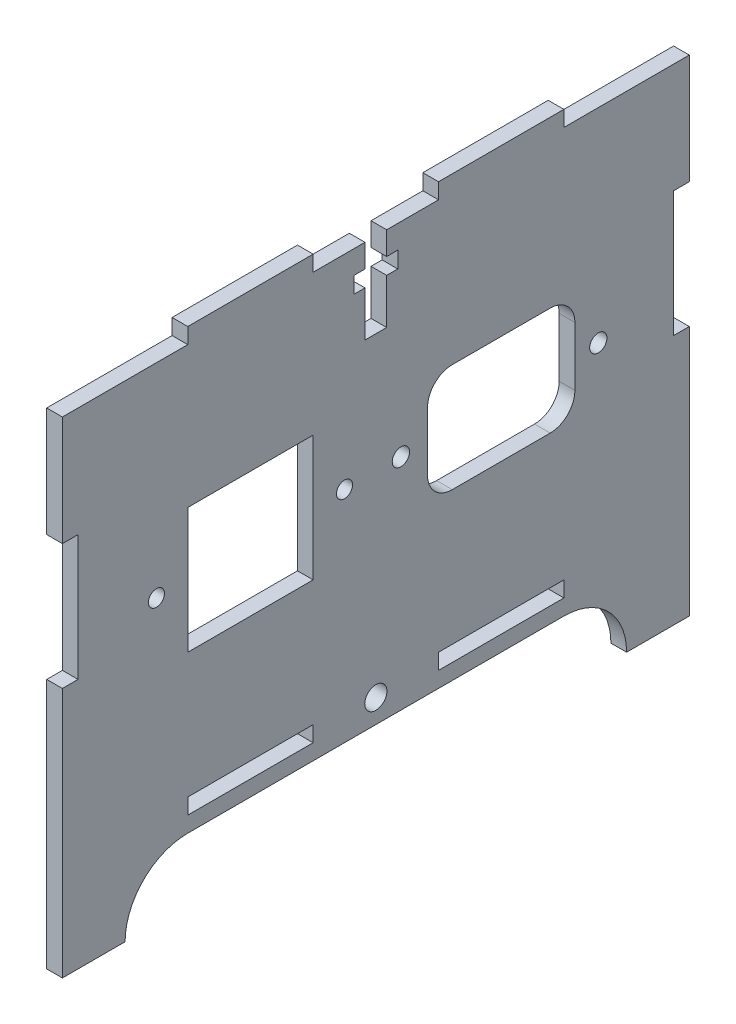
from build123d import *

# Parameters (mm, degrees)
SKETCH1_W                 = 127
SKETCH1_H                 = 101.6
BOSS_EXTRUDE1_DEPTH       = 3.175
SKETCH2_W                 = 25.4
SKETCH2_H                 = 3.175
CUT_EXTRUDE1_DEPTH        = 6.35
LPATTERN1_COUNT           = 3
LPATTERN1_PITCH           = 50.8
CUT_EXTRUDE4_DEPTH        = 6.35
SKETCH8_W                 = 3.175
SKETCH8_H                 = 25.4
CUT_EXTRUDE6_DEPTH        = 6.35
SKETCH9_W                 = 25.4
SKETCH9_H                 = 3.175
CUT_EXTRUDE7_DEPTH        = 6.35
LPATTERN6_COUNT           = 2
LPATTERN6_PITCH           = 50.8
SKETCH16_W                = 4.3942
SKETCH16_H                = 17.145
SKETCH16_W_2              = 8.89
SKETCH16_H_2              = 3.302
CUT_EXTRUDE14_DEPTH       = 6.35
F_8_CLEARANCE_HOLE1_D     = 4.4958
F_8_CLEARANCE_HOLE1_DEPTH = 10.16
F_8_CLEARANCE_HOLE1_TIP   = 1.350674586
SKETCH20_R                = 1.75
CUT_EXTRUDE16_DEPTH       = 7.62
SKETCH25_W                = 25.4
SKETCH25_H                = 25.4
CUT_EXTRUDE20_DEPTH       = 7.62
F_4_CLEARANCE_HOLE1_D     = 3.2639
F_4_CLEARANCE_HOLE1_DEPTH = 10.16
F_4_CLEARANCE_HOLE1_TIP   = 0.980574487


with BuildPart() as part:
    # Sketch1 → Boss-Extrude1 (new body)
    with BuildSketch(Plane(origin=(0, 0, 0), x_dir=(0, 0, -1), z_dir=(1, 0, 0))):
        Rectangle(SKETCH1_W, SKETCH1_H)
    extrude(amount=BOSS_EXTRUDE1_DEPTH)

    # Sketch2 → Cut-Extrude1 (cut)
    with BuildSketch(Plane(origin=(3.175, 0, 0), x_dir=(0, 0, -1), z_dir=(1, 0, 0))):
        with Locations((-50.8, 49.2125)):
            Rectangle(SKETCH2_W, SKETCH2_H)
    cut_extrude1 = extrude(amount=-CUT_EXTRUDE1_DEPTH, mode=Mode.SUBTRACT)

    # LPattern1: Cut-Extrude1 ×3
    with Locations(*[(0, 0, -i * LPATTERN1_PITCH) for i in range(1, LPATTERN1_COUNT)]):
        add(cut_extrude1, mode=Mode.SUBTRACT)

    # Sketch5 → Cut-Extrude4 (cut)
    with BuildSketch(Plane(origin=(3.175, 0, 0), x_dir=(0, 0, -1), z_dir=(1, 0, 0))):
        with BuildLine():
            Line((-38.1, -38.1), (38.1, -38.1))
            ThreePointArc((38.1, -38.1), (50.8, -50.8), (38.1, -63.5))
            Line((38.1, -63.5), (-38.1, -63.5))
            ThreePointArc((-38.1, -63.5), (-50.8, -50.8), (-38.1, -38.1))
        make_face()
    extrude(amount=-CUT_EXTRUDE4_DEPTH, mode=Mode.SUBTRACT)

    # Sketch8 → Cut-Extrude6 (cut)
    with BuildSketch(Plane(origin=(3.175, 0, 0), x_dir=(0, 0, -1), z_dir=(1, 0, 0))):
        with Locations((61.9125, 12.7)):
            Rectangle(SKETCH8_W, SKETCH8_H)
    cut_extrude6 = extrude(amount=-CUT_EXTRUDE6_DEPTH, mode=Mode.SUBTRACT)

    # Sketch9 → Cut-Extrude7 (cut)
    with BuildSketch(Plane.ZY):
        with Locations((-25.4, -33.3375)):
            Rectangle(SKETCH9_W, SKETCH9_H)
    cut_extrude7 = extrude(amount=-CUT_EXTRUDE7_DEPTH, mode=Mode.SUBTRACT)

    # LPattern6: Cut-Extrude7 ×2
    with Locations(*[(0, 0, i * LPATTERN6_PITCH) for i in range(1, LPATTERN6_COUNT)]):
        add(cut_extrude7, mode=Mode.SUBTRACT)

    # Sketch16 → Cut-Extrude14 (cut)
    with BuildSketch(Plane.ZY):
        with Locations((0, 39.0525)):
            Rectangle(SKETCH16_W, SKETCH16_H)
        with Locations((0, 41.275)):
            Rectangle(SKETCH16_W_2, SKETCH16_H_2)
    extrude(amount=-CUT_EXTRUDE14_DEPTH, mode=Mode.SUBTRACT)

    # #8 Clearance Hole1
    with Locations(Plane.ZY):
        with Locations((0, -33.3375)):
            Hole(F_8_CLEARANCE_HOLE1_D / 2, depth=F_8_CLEARANCE_HOLE1_DEPTH)
            with Locations((0, 0, -(F_8_CLEARANCE_HOLE1_DEPTH + F_8_CLEARANCE_HOLE1_TIP / 2))):  # 118° drill point
                Cone(0, F_8_CLEARANCE_HOLE1_D / 2, F_8_CLEARANCE_HOLE1_TIP, mode=Mode.SUBTRACT)

    # Sketch20 → Cut-Extrude16 (cut)
    with BuildSketch(Plane.ZY):
        with Locations((-45.0725, 6.35)):
            Circle(SKETCH20_R)
        with Locations((-5.0725, 6.35)):
            Circle(SKETCH20_R)
        with BuildLine():
            Line((-35.3225, 17.3101), (-15.4775, 17.3101))
            ThreePointArc((-15.4775, 17.3101), (-11.941966094, 15.845633906), (-10.4775, 12.3101))
            Line((-10.4775, 12.3101), (-10.4775, 0.3899))
            ThreePointArc((-10.4775, 0.3899), (-11.941966094, -3.145633906), (-15.4775, -4.6101))
            Line((-15.4775, -4.6101), (-35.3225, -4.6101))
            ThreePointArc((-35.3225, -4.6101), (-38.858033906, -3.145633906), (-40.3225, 0.3899))
            Line((-40.3225, 0.3899), (-40.3225, 12.3101))
            ThreePointArc((-40.3225, 12.3101), (-38.858033906, 15.845633906), (-35.3225, 17.3101))
        make_face()
    extrude(amount=-CUT_EXTRUDE16_DEPTH, mode=Mode.SUBTRACT)

    # Sketch25 → Cut-Extrude20 (cut)
    with BuildSketch(Plane.ZY):
        with Locations((25.4, 6.35)):
            Rectangle(SKETCH25_W, SKETCH25_H)
    extrude(amount=-CUT_EXTRUDE20_DEPTH, mode=Mode.SUBTRACT)

    # Mirror3: Cut-Extrude6 across plane
    add(cut_extrude6.mirror(Plane.XY), mode=Mode.SUBTRACT)

    # #4 Clearance Hole1
    with Locations(Plane(origin=(3.175, 0, 0), x_dir=(0, 0, -1), z_dir=(1, 0, 0))):
        with Locations((-44.45, 6.35), (-6.35, 6.35)):
            Hole(F_4_CLEARANCE_HOLE1_D / 2, depth=F_4_CLEARANCE_HOLE1_DEPTH)
            with Locations((0, 0, -(F_4_CLEARANCE_HOLE1_DEPTH + F_4_CLEARANCE_HOLE1_TIP / 2))):  # 118° drill point
                Cone(0, F_4_CLEARANCE_HOLE1_D / 2, F_4_CLEARANCE_HOLE1_TIP, mode=Mode.SUBTRACT)


solid = part.part
